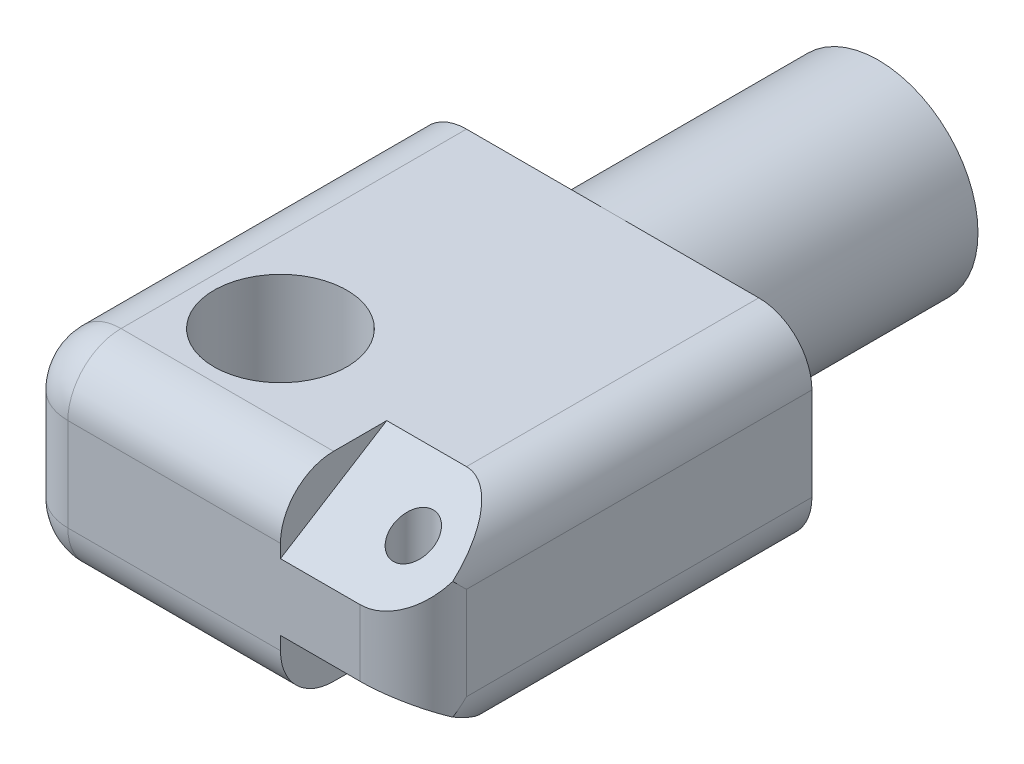
from build123d import *

# Parameters (mm, degrees)
SKETCH1_W           = 15
SKETCH1_H           = 15
SKETCH1_R           = 2.5
BOSS_EXTRUDE1_DEPTH = 7.5
SKETCH2_R           = 3.75
BOSS_EXTRUDE2_DEPTH = 10
SKETCH3_R           = 0.75
CUT_EXTRUDE1_DEPTH  = 7.5
CUT_EXTRUDE2_DEPTH  = 5
FILLET1_R           = 2


with BuildPart() as part:
    # Sketch1 → Boss-Extrude1 (new body)
    with BuildSketch(Plane(origin=(0, 0, 0), x_dir=(1, 0, 0), z_dir=(0, 1, 0))):
        with Locations((2.5, 2.5)):
            Rectangle(SKETCH1_W, SKETCH1_H)
        with Locations(Location((0, 0, 0), (0, 0, 270))):
            Circle(SKETCH1_R, mode=Mode.SUBTRACT)
    extrude(amount=BOSS_EXTRUDE1_DEPTH)

    # Sketch2 → Boss-Extrude2 (add)
    with BuildSketch(Plane(origin=(0, 0, -10), x_dir=(-1, 0, 0), z_dir=(0, 0, -1))):
        with Locations(Location((-2.5, 3.75, 0), (0, 0, 270))):
            Circle(SKETCH2_R)
    extrude(amount=BOSS_EXTRUDE2_DEPTH)

    # Sketch3 → Cut-Extrude1 (cut)
    with BuildSketch(Plane(origin=(0, 7.5, 0), x_dir=(1, 0, 0), z_dir=(0, 1, 0))):
        with Locations(Location((8, -3, 0), (0, 0, 270))):
            Circle(SKETCH3_R)
    extrude(amount=-CUT_EXTRUDE1_DEPTH, mode=Mode.SUBTRACT)

    # Sketch4 → Cut-Extrude2 (cut)
    with BuildSketch(Plane(origin=(10, 0, 0), x_dir=(0, 0, -1), z_dir=(1, 0, 0))):
        Polygon((-5, 7.5), (-1, 7.5), (-5, 5), align=None)
        Polygon((-5, 0), (-1, 0), (-5, 2.5), align=None)
    extrude(amount=-CUT_EXTRUDE2_DEPTH, mode=Mode.SUBTRACT)

    # Fillet1
    # the kernel refuses this fillet: 2 mm, written as the material it takes off along each edge
    with BuildSketch(Plane(origin=(-3, 2, 3), x_dir=(-1, 0, 0), z_dir=(0, 0, 1))) as fillet1_piece_1_section:
        Polygon((0, 0), (FILLET1_R, 0), (FILLET1_R, FILLET1_R), (0, FILLET1_R), align=None)
    fillet1_piece_1 = extrude(amount=FILLET1_R, mode=Mode.PRIVATE)
    fillet1_piece_1 = fillet1_piece_1 - Plane(origin=(-3, 2, 3), x_dir=(0.7071067811865475, 0.7071067811865475, 0), z_dir=(0, 0, 1)) * Sphere(FILLET1_R, mode=Mode.PRIVATE)
    add(fillet1_piece_1, mode=Mode.SUBTRACT)
    with BuildSketch(Plane(origin=(-3, 5.5, 3), x_dir=(-1, 0, 0), z_dir=(0, 0, 1))) as fillet1_piece_2_section:
        Polygon((0, 0), (FILLET1_R, 0), (FILLET1_R, -FILLET1_R), (0, -FILLET1_R), align=None)
    fillet1_piece_2 = extrude(amount=FILLET1_R, mode=Mode.PRIVATE)
    fillet1_piece_2 = fillet1_piece_2 - Plane(origin=(-3, 5.5, 3), x_dir=(0.7071067811865475, -0.7071067811865475, 0), z_dir=(0, 0, 1)) * Sphere(FILLET1_R, mode=Mode.PRIVATE)
    add(fillet1_piece_2, mode=Mode.SUBTRACT)
    with BuildSketch(Plane(origin=(10, -2.5, 5), x_dir=(-1, 0, 0), z_dir=(0, 1, 0))) as fillet1_piece_3:
        with BuildLine():
            CenterArc((FILLET1_R, -FILLET1_R), FILLET1_R, 90, 90)
            Line((0, -FILLET1_R), (0, 0))
            Line((0, 0), (FILLET1_R, 0))
        make_face()
    extrude(amount=12.5, mode=Mode.SUBTRACT)
    with BuildSketch(Plane(origin=(-5, 2, 5), x_dir=(1, 0, 0), z_dir=(0, 1, 0))) as fillet1_piece_4:
        with BuildLine():
            CenterArc((FILLET1_R, FILLET1_R), FILLET1_R, 180, 90)
            Line((0, FILLET1_R), (0, 0))
            Line((0, 0), (FILLET1_R, 0))
        make_face()
    extrude(amount=3.5, mode=Mode.SUBTRACT)
    with BuildSketch(Plane(origin=(-5, 0, -15), x_dir=(1, 0, 0), z_dir=(0, 0, 1))) as fillet1_piece_5:
        with BuildLine():
            CenterArc((FILLET1_R, FILLET1_R), FILLET1_R, 180, 90)
            Line((0, FILLET1_R), (0, 0))
            Line((0, 0), (FILLET1_R, 0))
        make_face()
    extrude(amount=18, mode=Mode.SUBTRACT)
    with BuildSketch(Plane(origin=(-5, 7.5, -15), x_dir=(1, 0, 0), z_dir=(0, 0, 1))) as fillet1_piece_6:
        with BuildLine():
            CenterArc((FILLET1_R, -FILLET1_R), FILLET1_R, 90, 90)
            Line((0, -FILLET1_R), (0, 0))
            Line((0, 0), (FILLET1_R, 0))
        make_face()
    extrude(amount=18, mode=Mode.SUBTRACT)
    with BuildSketch(Plane(origin=(-3, 0, 5), x_dir=(0, 1, 0), z_dir=(1, 0, 0))) as fillet1_piece_7:
        with BuildLine():
            CenterArc((FILLET1_R, -FILLET1_R), FILLET1_R, 90, 90)
            Line((0, -FILLET1_R), (0, 0))
            Line((0, 0), (FILLET1_R, 0))
        make_face()
    extrude(amount=13, mode=Mode.SUBTRACT)
    with BuildSketch(Plane(origin=(10, 0, 6), x_dir=(-1, 0, 0), z_dir=(0, 0, -1)), Plane(origin=(10, 7.5, 6), x_dir=(0, -1, 0), z_dir=(0, 0, -1))) as fillet1_piece_8:
        with BuildLine():
            CenterArc((FILLET1_R, FILLET1_R), FILLET1_R, 180, 90)
            Line((0, FILLET1_R), (0, 0))
            Line((0, 0), (FILLET1_R, 0))
        make_face()
    extrude(amount=21, mode=Mode.SUBTRACT)
    with BuildSketch(Plane(origin=(-3, 7.5, 5), x_dir=(0, -1, 0), z_dir=(1, 0, 0))) as fillet1_piece_9:
        with BuildLine():
            CenterArc((FILLET1_R, FILLET1_R), FILLET1_R, 180, 90)
            Line((0, FILLET1_R), (0, 0))
            Line((0, 0), (FILLET1_R, 0))
        make_face()
    extrude(amount=13, mode=Mode.SUBTRACT)


solid = part.part
